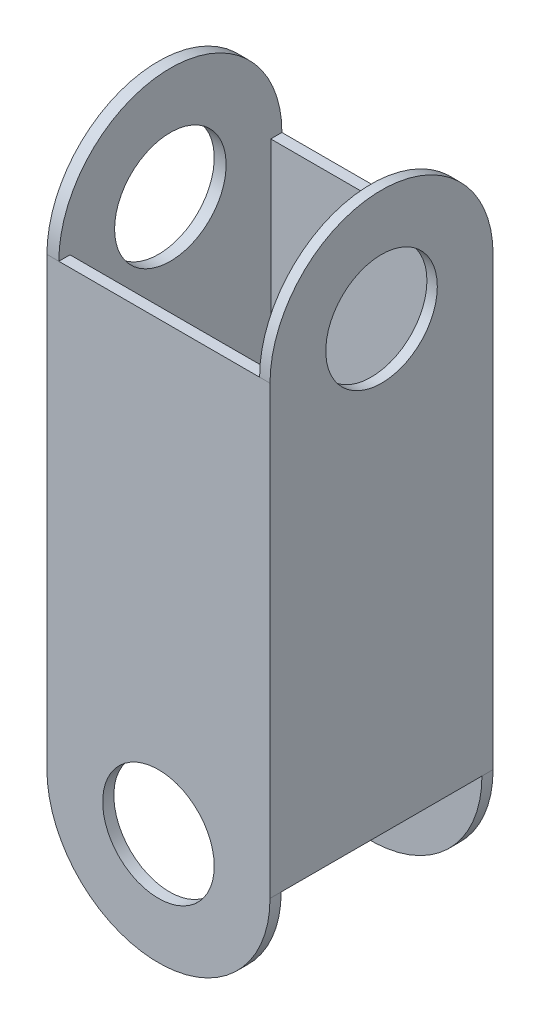
from build123d import *
from OCP.BRepAlgoAPI import BRepAlgoAPI_Cut
from OCP.TopTools import TopTools_ListOfShape

# Parameters (mm, degrees)
SKETCH1_W                = 20
SKETCH1_H                = 40
BOSS_EXTRUDE1_DEPTH      = 20
SKETCH3_W                = 18
SKETCH3_H                = 18
CUT_EXTRUDE1_DEPTH       = 20
BOSS_EXTRUDE2_START      = -1
BOSS_EXTRUDE2_DEPTH      = 1
BOSS_EXTRUDE3_START      = -1
SKETCH4_R                = 10
SKETCH4_R_2              = 5
BOSS_EXTRUDE3_DEPTH      = 1
SKETCH5_W                = 18
SKETCH5_H                = 18
CUT_EXTRUDE3_DEPTH       = 18
BOSS_EXTRUDE4_START      = -0.931933
SKETCH8_R                = 10
SKETCH8_R_2              = 5
BOSS_EXTRUDE4_DEPTH      = 0.931933
BOSS_EXTRUDE5_START      = -1.068067
BOSS_EXTRUDE5_DEPTH      = 1.068067
CUT_EXTRUDE4_OUTLINE_W   = 5
CUT_EXTRUDE4_OUTLINE_H   = 0.931933326
CUT_EXTRUDE4_OUTLINE_H_2 = 1.068066674
SKETCH12_R               = 5
CUT_EXTRUDE5_DEPTH       = 42.231056256


with BuildPart() as part:
    # Sketch1 → Boss-Extrude1 (new body)
    with BuildSketch(Plane(origin=(0, 0, 0), x_dir=(0, 0, -1), z_dir=(1, 0, 0))):
        Rectangle(SKETCH1_W, SKETCH1_H)
    extrude(amount=BOSS_EXTRUDE1_DEPTH)

    # Sketch3 → Cut-Extrude1 (cut)
    with BuildSketch(Plane.XZ.offset(20)):
        with Locations((9.965966663, 0)):
            Rectangle(SKETCH3_W, SKETCH3_H)
    extrude(amount=-CUT_EXTRUDE1_DEPTH, mode=Mode.SUBTRACT)

    # Sketch2 → Boss-Extrude2 (add)
    with BuildSketch(Plane.XY.offset(10).offset(BOSS_EXTRUDE2_START)):
        with BuildLine():
            ThreePointArc((0, -20), (10, -30), (20, -20))
            Line((20, -20), (0, -20))
        make_face()
    extrude(amount=BOSS_EXTRUDE2_DEPTH)

    # Sketch4 → Boss-Extrude3 (add)
    with BuildSketch(Plane(origin=(0, 0, -10), x_dir=(-1, 0, 0), z_dir=(0, 0, -1)).offset(BOSS_EXTRUDE3_START)):
        with Locations((-10, -20)):
            Circle(SKETCH4_R)
        with Locations((-10, -20)):
            Circle(SKETCH4_R_2, mode=Mode.SUBTRACT)
    extrude(amount=BOSS_EXTRUDE3_DEPTH)

    # Sketch5 → Cut-Extrude3 (cut)
    with BuildSketch(Plane(origin=(0, 20, 0), x_dir=(1, 0, 0), z_dir=(0, 1, 0))):
        with Locations((10.068066674, 0)):
            Rectangle(SKETCH5_W, SKETCH5_H)
    extrude(amount=-CUT_EXTRUDE3_DEPTH, mode=Mode.SUBTRACT)

    # Sketch8 → Boss-Extrude4 (add)
    with BuildSketch(Plane(origin=(20, 0, 0), x_dir=(0, 0, -1), z_dir=(1, 0, 0)).offset(BOSS_EXTRUDE4_START)):
        with Locations((0, 20)):
            Circle(SKETCH8_R)
        with Locations((0, 20)):
            Circle(SKETCH8_R_2, mode=Mode.SUBTRACT)
    extrude(amount=BOSS_EXTRUDE4_DEPTH)

    # Sketch7 → Boss-Extrude5 (add)
    with BuildSketch(Plane.ZY.offset(BOSS_EXTRUDE5_START)):
        with BuildLine():
            ThreePointArc((10, 20), (0, 30), (-10, 20))
            Line((-10, 20), (10, 20))
        make_face()
    extrude(amount=BOSS_EXTRUDE5_DEPTH)


with BuildPart() as cut_extrude4_tool:
    # Cut-Extrude4: read off the stored shape, not the designer's step
    # Cut-Extrude4 outline → Cut-Extrude4 (revolve)
    with BuildSketch(Plane(origin=(0, 20, 0), x_dir=(0, 1, 0), z_dir=(0, 0, -1))):
        with Locations((2.5, 19.534033337)):
            Rectangle(CUT_EXTRUDE4_OUTLINE_W, CUT_EXTRUDE4_OUTLINE_H)
        with Locations((2.5, 0.534033337)):
            Rectangle(CUT_EXTRUDE4_OUTLINE_W, CUT_EXTRUDE4_OUTLINE_H_2)
    revolve(axis=Axis((0, 20, 0), (1, 0, 0)))


with BuildPart() as part_1:
    add(part.part)

    # Cut-Extrude4: cut by cut_extrude4_tool, with a tolerance
    cut_extrude4_stock = TopTools_ListOfShape()
    cut_extrude4_stock.Append(part_1.part.wrapped)
    cut_extrude4_tools = TopTools_ListOfShape()
    cut_extrude4_tools.Append(cut_extrude4_tool.part.wrapped)
    cut_extrude4_cut = BRepAlgoAPI_Cut()
    cut_extrude4_cut.SetArguments(cut_extrude4_stock)
    cut_extrude4_cut.SetTools(cut_extrude4_tools)
    cut_extrude4_cut.SetFuzzyValue(0.00001)
    cut_extrude4_cut.Build()
    add(Compound.cast(cut_extrude4_cut.Shape()).solids(), mode=Mode.REPLACE)

    # Sketch12 → Cut-Extrude5 (cut, through all)
    with BuildSketch(Plane.XY.offset(10)):
        with Locations(Location((10, -20, 0), (0, 0, 90))):
            Circle(SKETCH12_R)
    extrude(amount=-CUT_EXTRUDE5_DEPTH, mode=Mode.SUBTRACT)


solid = part_1.part
